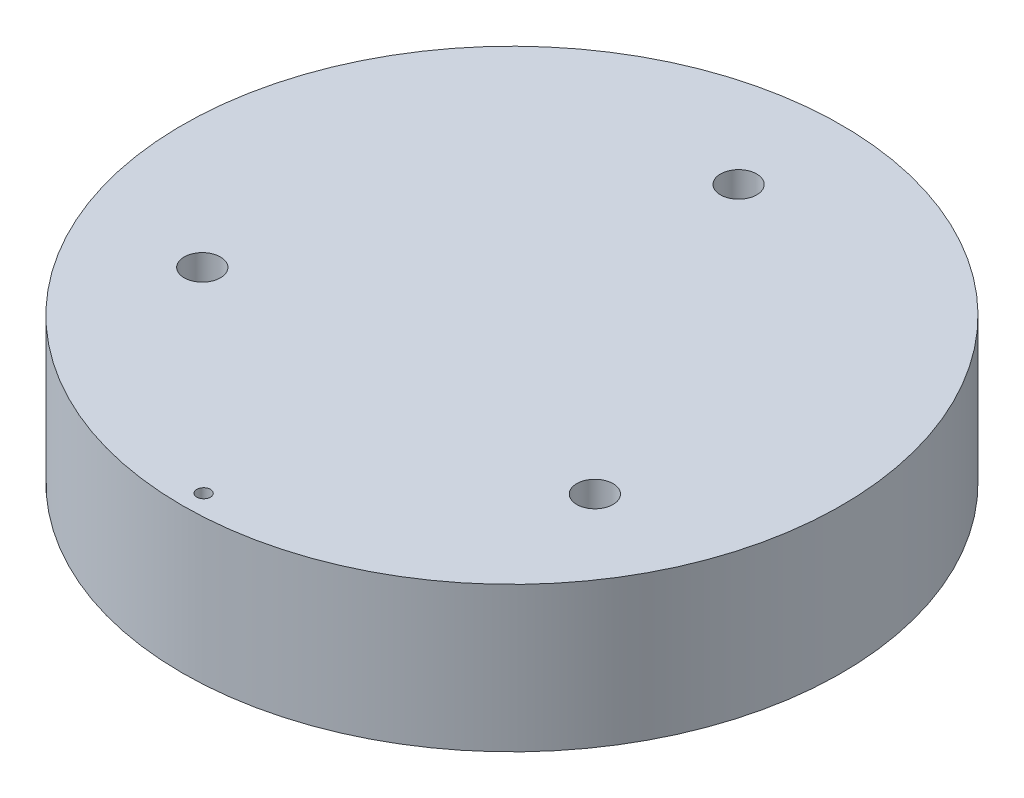
from build123d import *

# Parameters (mm, degrees)
SKETCH1_R           = 72.7
BOSS_EXTRUDE1_DEPTH = 32
SKETCH2_R           = 4
CUT_EXTRUDE1_DEPTH  = 108.678131485
CIRPATTERN1_COUNT   = 3
SKETCH3_R           = 1.5
CUT_EXTRUDE2_DEPTH  = 108.678131485


with BuildPart() as part:
    # Sketch1 → Boss-Extrude1 (new body)
    with BuildSketch(Plane(origin=(0, 0, 0), x_dir=(1, 0, 0), z_dir=(0, 1, 0))):
        Circle(SKETCH1_R)
    extrude(amount=BOSS_EXTRUDE1_DEPTH)

    # Sketch2 → Cut-Extrude1 (cut, through all)
    with BuildSketch(Plane(origin=(0, 32, 0), x_dir=(1, 0, 0), z_dir=(0, 1, 0))):
        with Locations((0, 50)):
            Circle(SKETCH2_R)
    cut_extrude1 = extrude(amount=-CUT_EXTRUDE1_DEPTH, mode=Mode.SUBTRACT)

    # CirPattern1: Cut-Extrude1 ×3 about axis
    cirpattern1_axis = Axis((0, 33.6, 0), (0, -1, 0))
    for i in range(1, CIRPATTERN1_COUNT):
        add(cut_extrude1.rotate(cirpattern1_axis, i * 360 / CIRPATTERN1_COUNT), mode=Mode.SUBTRACT)

    # Sketch3 → Cut-Extrude2 (cut, through all)
    with BuildSketch(Plane(origin=(0, 32, 0), x_dir=(1, 0, 0), z_dir=(0, 1, 0))):
        with Locations((0, -68)):
            Circle(SKETCH3_R)
    extrude(amount=-CUT_EXTRUDE2_DEPTH, mode=Mode.SUBTRACT)


solid = part.part
